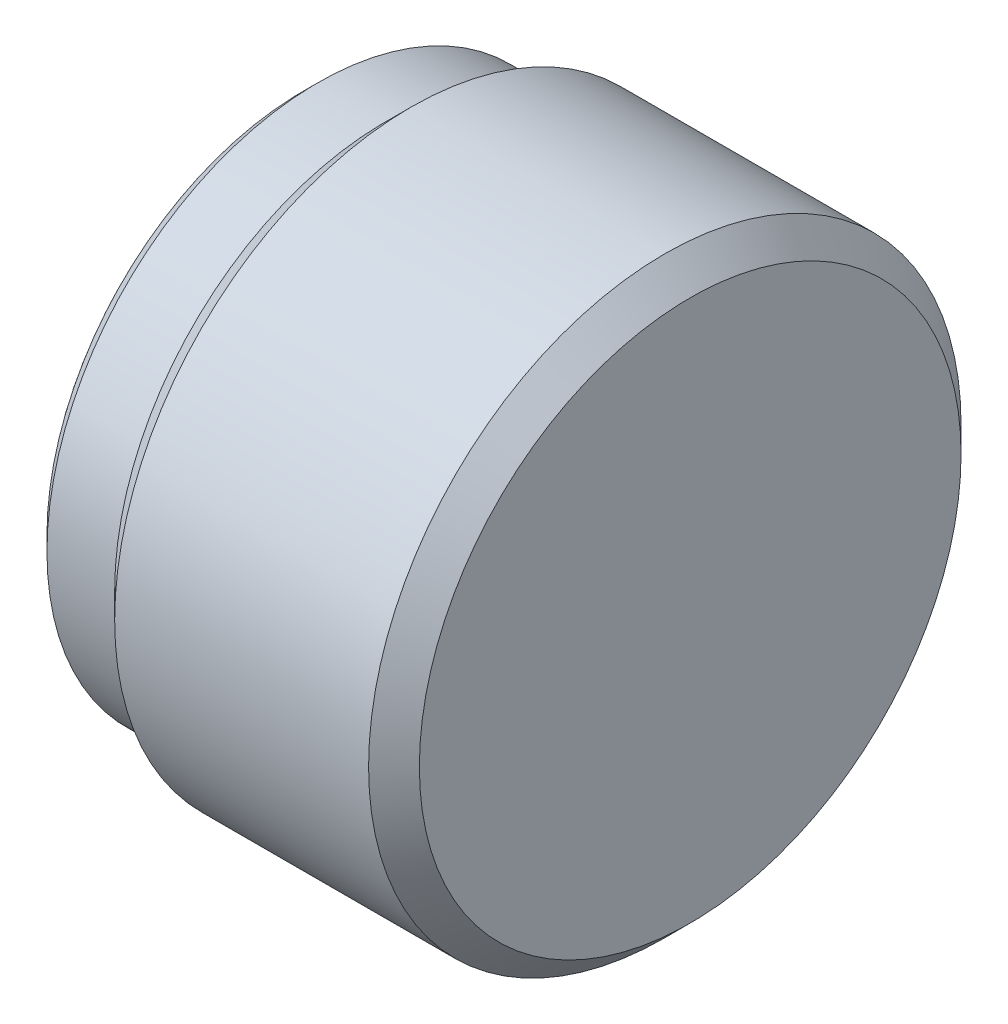
from build123d import *

# Parameters (mm, degrees)
SKETCH_1_W               = 16.3
SKETCH_1_H               = 3
SKETCH_1_W_2             = 5
SKETCH_1_H_2             = 16
SKETCH_19_W              = 3
SKETCH_19_H              = 0.05
EXTRUDE_START            = 14
SKETCH_20_R              = 18
EXTRUDE_2_DEPTH          = 14
CUT_EXTRUDE_6_DEPTH      = 3
CUT_EXTRUDE_4_DEPTH      = 12
SKETCH_13_R              = 1.5
CUT_EXTRUDE_8_DEPTH      = 7
PATTERN_CIRCULAR_2_COUNT = 4
FILLET_1_R               = 0.5
SKETCH_21_R              = 20
CUT_EXTRUDE_7_DEPTH      = 76
SKETCH_23_R              = 3
CUT_EXTRUDE_8_2_DEPTH    = 16.3


with BuildPart() as part:
    # Эскиз1 → Повернуть1 основной корпус (revolve)
    with BuildSketch(Plane(origin=(0, 0, 0), x_dir=(1, 0, 0), z_dir=(0, 1, 0)), mode=Mode.PRIVATE) as revolve_1_sk:
        with Locations((8.15, 1.5)):
            Rectangle(SKETCH_1_W, SKETCH_1_H)
        Polygon((16.3, 0), (19.3, 0), (19.3, 10), (16.3, 10), (16.3, 3), align=None)
        Polygon((24.3, 0), (24.3, 16), (20.3, 16), (19.3, 15), (19.3, 10), (19.3, 0), align=None)
        Polygon((40.8, 17.5), (42.3, 16), (42.3, 0), (24.3, 0), (24.3, 16), (25.8, 17.5), align=None)
        with Locations((44.8, 8)):
            Rectangle(SKETCH_1_W_2, SKETCH_1_H_2)
        with BuildLine():
            ThreePointArc((47.3, 16), (47.885786438, 17.414213562), (49.3, 18))
            Line((49.3, 18), (104.3, 18))
            Line((104.3, 18), (104.3, 0))
            Line((104.3, 0), (47.3, 0))
            Line((47.3, 0), (47.3, 16))
        make_face()
    revolve(revolve_1_sk.sketch.rotate(Axis((0, 0, 0), (1, 0, 0)), 180), axis=Axis((0, 0, 0), (1, 0, 0)))

    # Эскиз19 → Вырез-Повернуть2 пластиковая часть (revolve, cut)
    with BuildSketch(Plane(origin=(0, 0, 0), x_dir=(1, 0, 0), z_dir=(0, 1, 0)), mode=Mode.PRIVATE) as cut_revolve_2_sk:
        with Locations((102.8, 17.975)):
            Rectangle(SKETCH_19_W, SKETCH_19_H)
    revolve(cut_revolve_2_sk.sketch.rotate(Axis((103.004702911, 0, 0), (-1, 0, 0)), 180), axis=Axis((103.004702911, 0, 0), (-1, 0, 0)), mode=Mode.SUBTRACT)

    # Эскиз20 → Бобышка-Вытянуть2 пластиковая крышка контактов (add)
    with BuildSketch(Plane(origin=(104.3, 0, 0), x_dir=(0, 0, -1), z_dir=(1, 0, 0)).offset(EXTRUDE_START)):
        with Locations(Location((0, 0, 0), (0, 0, 180))):
            Circle(SKETCH_20_R)
    extrude(amount=-EXTRUDE_2_DEPTH)

    # Эскиз11 → Вырез-Вытянуть6 (cut)
    with BuildSketch(Plane.ZY.offset(-16.3)):
        with BuildLine():
            ThreePointArc((4.358898944, 9), (0, 10), (-4.358898944, 9))
            Line((-4.358898944, 9), (4.358898944, 9))
        make_face()
        with BuildLine():
            Line((4.358898944, -9), (-4.358898944, -9))
            ThreePointArc((-4.358898944, -9), (0, -10), (4.358898944, -9))
        make_face()
    extrude(amount=-CUT_EXTRUDE_6_DEPTH, mode=Mode.SUBTRACT)

    # Эскиз6 → Вырез-Вытянуть4 на оси (cut)
    with BuildSketch(Plane.ZY):
        with BuildLine():
            Line((-1.75306936, 2.434491286), (1.561110291, 2.561822527))
            ThreePointArc((1.561110291, 2.561822527), (-0.115175441, 2.997788288), (-1.75306936, 2.434491286))
        make_face()
    extrude(amount=-CUT_EXTRUDE_4_DEPTH, mode=Mode.SUBTRACT)

    # Эскиз13 → Cut-Extrude 8 (cut)
    with BuildSketch(Plane.ZY.offset(-19.3)):
        with Locations((-9.192388155, 9.192388155)):
            Circle(SKETCH_13_R)
    cut_extrude_8 = extrude(amount=-CUT_EXTRUDE_8_DEPTH, mode=Mode.SUBTRACT)

    # Круговой массив2 для винтов: Cut-Extrude 8 ×4 about axis
    pattern_circular_2_axis = Axis((0, 0, 0), (1, 0, 0))
    for i in range(1, PATTERN_CIRCULAR_2_COUNT):
        add(cut_extrude_8.rotate(pattern_circular_2_axis, i * 360 / PATTERN_CIRCULAR_2_COUNT), mode=Mode.SUBTRACT)

    # Скругление1
    # the kernel refuses this fillet: 0.5 mm, written as the material it takes off along each edge
    with BuildSketch(Plane(origin=(19.3, 0, 0), x_dir=(0, 0, 1), z_dir=(0, 1, 0))) as fillet_1_piece_1:
        with BuildLine():
            CenterArc((15 - FILLET_1_R * 0.414213562373, FILLET_1_R), FILLET_1_R, 270, 45)
            Line((15 - FILLET_1_R * 0.414213562373, 0), (15, 0))
            Line((15, 0), (15 + FILLET_1_R * 0.292893218813, FILLET_1_R * 0.292893218813))
        make_face()
    revolve(axis=Axis((19.3, 0, 0), (1, 0, 0)), mode=Mode.SUBTRACT)
    with BuildSketch(Plane(origin=(118.3, 0, 0), x_dir=(0, 0, 1), z_dir=(0, 1, 0))) as fillet_1_piece_2:
        with BuildLine():
            CenterArc((18 - FILLET_1_R, -FILLET_1_R), FILLET_1_R, 0, 90)
            Line((18 - FILLET_1_R, 0), (18, 0))
            Line((18, 0), (18, -FILLET_1_R))
        make_face()
    revolve(axis=Axis((118.3, 0, 0), (1, 0, 0)), mode=Mode.SUBTRACT)
    with BuildSketch(Plane(origin=(16.001803864, 9, -4.358898944), x_dir=(0, 0, 1), z_dir=(1, 0, 0))) as fillet_1_piece_3:
        with BuildLine():
            CenterArc((0.116258256, 0.5), FILLET_1_R, 243.474647983, 26.525352017)
            ThreePointArc((-0.107038622, 0.052631579), (-0.053597784, 0.026156196), (0, 0))
            Line((0, 0), (0.116258256, 0))
        make_face()
    extrude(amount=3.298196136, mode=Mode.SUBTRACT)
    with BuildSketch(Plane(origin=(16.001803864, 9, 4.358898944), x_dir=(0, -0.4412496727830022, 0.8973843804462464), z_dir=(1, 0, 0))) as fillet_1_piece_4:
        with BuildLine():
            CenterArc((0.116296493, 0.499991108), FILLET_1_R, 243.81635761, 26.525352017)
            Line((-0.104328343, 0.051298918), (0, 0))
            ThreePointArc((0, 0), (0.059639227, -0.000177843), (0.119278454, 0))
        make_face()
    extrude(amount=3.298196136, mode=Mode.SUBTRACT)
    with BuildSketch(Plane(origin=(16.3, 9, -5.608898944), x_dir=(1, 0, 0), z_dir=(0, 0, 1)), Plane(origin=(16.3, -9, 5.608898944), x_dir=(1, 0, 0), z_dir=(0, 0, -1))) as fillet_1_piece_5:
        with BuildLine():
            CenterArc((FILLET_1_R, -FILLET_1_R), FILLET_1_R, 90, 90)
            Line((0, -FILLET_1_R), (0, 0))
            Line((0, 0), (FILLET_1_R, 0))
        make_face()
    extrude(amount=11.217797887, mode=Mode.SUBTRACT)
    with BuildSketch(Plane(origin=(16.001803864, -9, 4.358898944), x_dir=(0, 0.4412496727830018, 0.8973843804462466), z_dir=(1, 0, 0))) as fillet_1_piece_6:
        with BuildLine():
            CenterArc((0.116296493, -0.499991108), FILLET_1_R, 89.658290373, 26.525352017)
            Line((-0.104328343, -0.051298918), (0, 0))
            ThreePointArc((0, 0), (0.059639227, 0.000177843), (0.119278454, 0))
        make_face()
    extrude(amount=3.298196136, mode=Mode.SUBTRACT)
    with BuildSketch(Plane(origin=(16.001803864, -9, -4.358898944), x_dir=(0, 0, 1), z_dir=(1, 0, 0))) as fillet_1_piece_7:
        with BuildLine():
            CenterArc((0.116258256, -0.5), FILLET_1_R, 90, 26.525352017)
            ThreePointArc((-0.107038622, -0.052631579), (-0.053597784, -0.026156196), (0, 0))
            Line((0, 0), (0.116258256, 0))
        make_face()
    extrude(amount=3.298196136, mode=Mode.SUBTRACT)
    with BuildSketch(Plane(origin=(19.3, 9.192388155, -9.192388155), x_dir=(0, 0, 1), z_dir=(0, -1, 0))) as fillet_1_piece_8:
        with BuildLine():
            CenterArc((1.5 + FILLET_1_R, -FILLET_1_R), FILLET_1_R, 90, 90)
            Line((1.5, -FILLET_1_R), (1.5, 0))
            Line((1.5, 0), (1.5 + FILLET_1_R, 0))
        make_face()
    revolve(axis=Axis((19.3, 9.192388155, -9.192388155), (-1, 0, 0)), mode=Mode.SUBTRACT)
    with BuildSketch(Plane(origin=(19.3, -9.192388155, -9.192388155), x_dir=(0, 1, 0), z_dir=(0, 0, 1))) as fillet_1_piece_9:
        with BuildLine():
            CenterArc((1.5 + FILLET_1_R, -FILLET_1_R), FILLET_1_R, 90, 90)
            Line((1.5, -FILLET_1_R), (1.5, 0))
            Line((1.5, 0), (1.5 + FILLET_1_R, 0))
        make_face()
    revolve(axis=Axis((19.3, -9.192388155, -9.192388155), (-1, 0, 0)), mode=Mode.SUBTRACT)
    with BuildSketch(Plane(origin=(19.3, -9.192388155, 9.192388155), x_dir=(0, 0, -1), z_dir=(0, 1, 0))) as fillet_1_piece_10:
        with BuildLine():
            CenterArc((1.5 + FILLET_1_R, -FILLET_1_R), FILLET_1_R, 90, 90)
            Line((1.5, -FILLET_1_R), (1.5, 0))
            Line((1.5, 0), (1.5 + FILLET_1_R, 0))
        make_face()
    revolve(axis=Axis((19.3, -9.192388155, 9.192388155), (-1, 0, 0)), mode=Mode.SUBTRACT)
    with BuildSketch(Plane(origin=(19.3, 9.192388155, 9.192388155), x_dir=(0, -1, 0), z_dir=(0, 0, -1))) as fillet_1_piece_11:
        with BuildLine():
            CenterArc((1.5 + FILLET_1_R, -FILLET_1_R), FILLET_1_R, 90, 90)
            Line((1.5, -FILLET_1_R), (1.5, 0))
            Line((1.5, 0), (1.5 + FILLET_1_R, 0))
        make_face()
    revolve(axis=Axis((19.3, 9.192388155, 9.192388155), (-1, 0, 0)), mode=Mode.SUBTRACT)
    # the kernel refuses this fillet: 0.5 mm, written as the material it adds along each edge
    with BuildSketch(Plane(origin=(19.3, 0, 0), x_dir=(0, -0.8947368421052432, -0.4465937565389121), z_dir=(0, -0.4465937565389121, 0.8947368421052432))) as fillet_1_2_piece_1:
        with BuildLine():
            CenterArc((10 + FILLET_1_R, -FILLET_1_R), FILLET_1_R, 90, 90)
            Line((10, -FILLET_1_R), (10, 0))
            Line((10, 0), (10 + FILLET_1_R, 0))
        make_face()
    revolve(axis=Axis((19.3, 0, 0), (1, 0, 0)), revolution_arc=126.949295967)
    with BuildSketch(Plane(origin=(19.3, 9, -4.242640687), x_dir=(0, 1, 0), z_dir=(0, 0, 1)), Plane(origin=(19.3, -9, 4.242640687), x_dir=(0, -1, 0), z_dir=(0, 0, -1))) as fillet_1_2_piece_2:
        with BuildLine():
            CenterArc((FILLET_1_R, FILLET_1_R), FILLET_1_R, 180, 90)
            Line((0, FILLET_1_R), (0, 0))
            Line((0, 0), (FILLET_1_R, 0))
        make_face()
    extrude(amount=8.485281374)
    with BuildSketch(Plane(origin=(19.3, 0, 0), x_dir=(0, 0.894736842105243, 0.44659375653891253), z_dir=(0, 0.44659375653891253, -0.894736842105243))) as fillet_1_2_piece_3:
        with BuildLine():
            CenterArc((10 + FILLET_1_R, -FILLET_1_R), FILLET_1_R, 90, 90)
            Line((10, -FILLET_1_R), (10, 0))
            Line((10, 0), (10 + FILLET_1_R, 0))
        make_face()
    revolve(axis=Axis((19.3, 0, 0), (1, 0, 0)), revolution_arc=126.949295967)
    with BuildSketch(Plane(origin=(19.3, -8.5, 4.242640687), x_dir=(0, -0.8947368421052433, 0.446593756538912), z_dir=(0, 0.446593756538912, 0.8947368421052433))) as fillet_1_2_piece_4:
        with BuildLine():
            CenterArc((0.5 + FILLET_1_R, -FILLET_1_R), FILLET_1_R, 90, 90)
            Line((0.5, -FILLET_1_R), (0.5, 0))
            Line((0.5, 0), (0.5 + FILLET_1_R, 0))
        make_face()
    revolve(axis=Axis((19.3, -8.5, 4.242640687), (1, 0, 0)), revolution_arc=26.525352017)
    with BuildSketch(Plane(origin=(19.3, -8.5, -4.242640687), x_dir=(0, -1, 0), z_dir=(0, 0, 1))) as fillet_1_2_piece_5:
        with BuildLine():
            CenterArc((0.5 + FILLET_1_R, -FILLET_1_R), FILLET_1_R, 90, 90)
            Line((0.5, -FILLET_1_R), (0.5, 0))
            Line((0.5, 0), (0.5 + FILLET_1_R, 0))
        make_face()
    revolve(axis=Axis((19.3, -8.5, -4.242640687), (1, 0, 0)), revolution_arc=26.525352017)
    with BuildSketch(Plane(origin=(19.3, 8.5, 4.242640687), x_dir=(0, 0.8947368421052433, 0.446593756538912), z_dir=(0, -0.446593756538912, 0.8947368421052433))) as fillet_1_2_piece_6:
        with BuildLine():
            CenterArc((0.5 + FILLET_1_R, FILLET_1_R), FILLET_1_R, 180, 90)
            Line((0.5, FILLET_1_R), (0.5, 0))
            Line((0.5, 0), (0.5 + FILLET_1_R, 0))
        make_face()
    revolve(axis=Axis((19.3, 8.5, 4.242640687), (-1, 0, 0)), revolution_arc=26.525352017)
    with BuildSketch(Plane(origin=(19.3, 8.5, -4.242640687), x_dir=(0, 1, 0), z_dir=(0, 0, 1))) as fillet_1_2_piece_7:
        with BuildLine():
            CenterArc((0.5 + FILLET_1_R, FILLET_1_R), FILLET_1_R, 180, 90)
            Line((0.5, FILLET_1_R), (0.5, 0))
            Line((0.5, 0), (0.5 + FILLET_1_R, 0))
        make_face()
    revolve(axis=Axis((19.3, 8.5, -4.242640687), (-1, 0, 0)), revolution_arc=26.525352017)

    # Эскиз21 → Вырез-Вытянуть7 (cut)
    with BuildSketch(Plane(origin=(118.3, 0, 0), x_dir=(0, 0, -1), z_dir=(1, 0, 0))):
        Circle(SKETCH_21_R)
    extrude(amount=-CUT_EXTRUDE_7_DEPTH, mode=Mode.SUBTRACT)

    # Эскиз23 → Cut-Extrude 8 2 (cut)
    with BuildSketch(Plane.ZY):
        Circle(SKETCH_23_R)
    extrude(amount=-CUT_EXTRUDE_8_2_DEPTH, mode=Mode.SUBTRACT)


solid = part.part
